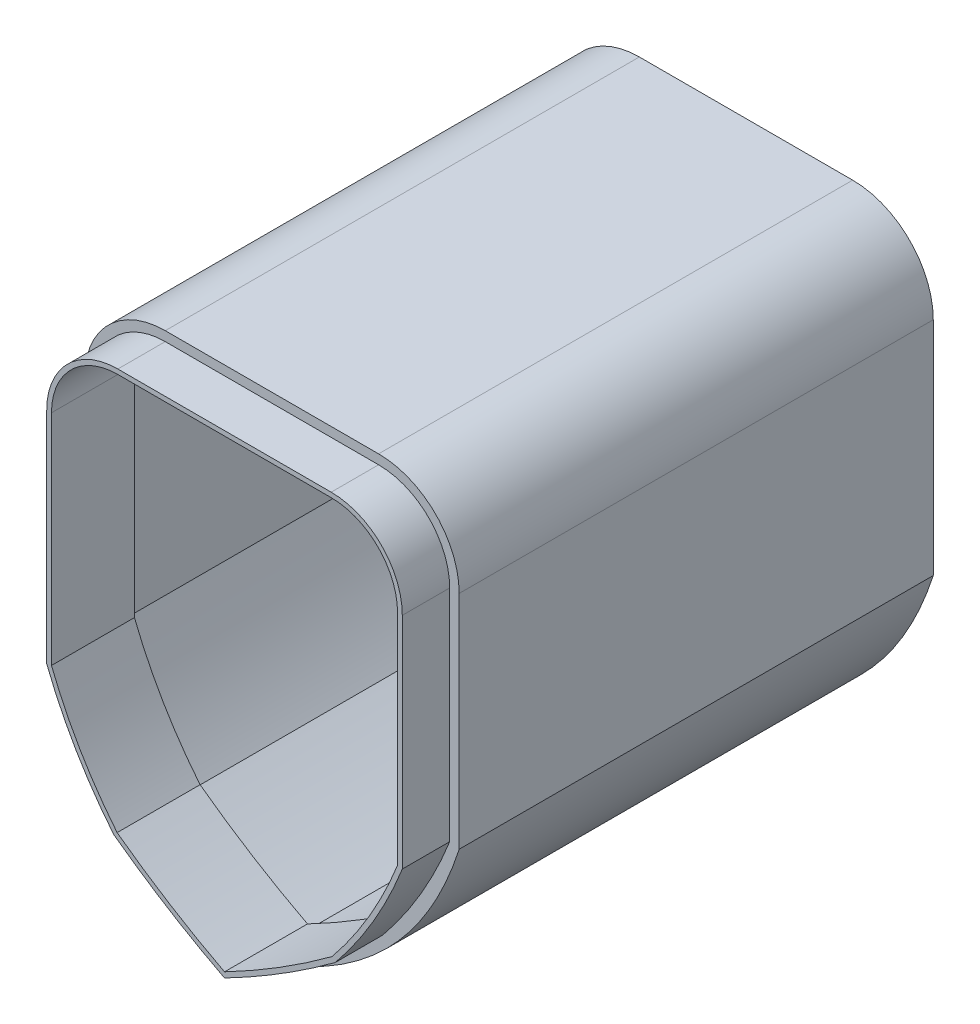
from build123d import *

# Parameters (mm, degrees)
EXTRU_MINCE2_DEPTH      = 200
EPAISSIR5_DEPTH         = 200
EPAISSIR7_DEPTH         = 200
EXTRU_MINCE3_DEPTH      = 20
EXTRU_MINCE3_DEPTH_BACK = 15


# Read off the part's stored shape, not the designer's step: Epaissir5, Epaissir7
with BuildPart() as part:
    # Esquisse3 → Extru.-Mince2 (new body)
    with BuildSketch(Plane.XY):
        with BuildLine():
            Line((-206.649507199, -11.92714811), (-206.649507199, -3.47401752))
            Line((-206.649507199, -3.47401752), (-206.649507199, 81.52598248))
            ThreePointArc((-206.649507199, 81.52598248), (-196.691137759, 105.56761304), (-172.649507199, 115.52598248))
            Line((-172.649507199, 115.52598248), (-82.649507199, 115.52598248))
            ThreePointArc((-82.649507199, 115.52598248), (-58.607876638, 105.56761304), (-48.649507199, 81.52598248))
            Line((-48.649507199, 81.52598248), (-48.649507199, -11.92714811))
            ThreePointArc((-48.649507199, -11.92714811), (-61.399009455, -38.338842544), (-78.173060849, -62.396244951))
            ThreePointArc((-78.173060849, -62.396244951), (-102.275198337, -78.711501116), (-127.649507199, -92.967905467))
            ThreePointArc((-127.649507199, -92.967905467), (-153.023816061, -78.711501116), (-177.125953549, -62.396244951))
            ThreePointArc((-177.125953549, -62.396244951), (-193.900004942, -38.338842544), (-206.649507199, -11.92714811))
        make_face()
        with BuildLine():
            Line((-202.649507199, -11.17401752), (-202.649507199, -3.47401752))
            Line((-202.649507199, -3.47401752), (-202.649507199, 81.52598248))
            ThreePointArc((-202.649507199, 81.52598248), (-193.862710634, 102.739185916), (-172.649507199, 111.52598248))
            Line((-172.649507199, 111.52598248), (-82.649507199, 111.52598248))
            ThreePointArc((-82.649507199, 111.52598248), (-61.436303763, 102.739185916), (-52.649507199, 81.52598248))
            Line((-52.649507199, 81.52598248), (-52.649507199, -11.17401752))
            ThreePointArc((-52.649507199, -11.17401752), (-64.915375774, -36.427970301), (-80.949507199, -59.47401752))
            ThreePointArc((-80.949507199, -59.47401752), (-103.722688687, -74.902894226), (-127.649507199, -88.47401752))
            ThreePointArc((-127.649507199, -88.47401752), (-151.57632571, -74.902894226), (-174.349507199, -59.47401752))
            ThreePointArc((-174.349507199, -59.47401752), (-190.383638623, -36.427970301), (-202.649507199, -11.17401752))
        make_face(mode=Mode.SUBTRACT)
    extrude(amount=EXTRU_MINCE2_DEPTH)

    # Epaissir5 outline → Epaissir5 (add)
    with BuildSketch(Plane.XY):
        with BuildLine():
            add(Edge.make_bspline(
                [(-78.173060849, -62.396244951), (-91.313583381, -75.858349648), (-107.794638855, -86.055391974), (-127.649507199, -92.967905467)],
                knots=[0.501331546, 0.501331546, 0.501331546, 0.501331546, 1, 1, 1, 1], degree=3))
            ThreePointArc((-78.173060849, -62.396244951), (-102.275198337, -78.711501116), (-127.649507199, -92.967905467))
        make_face()
        with BuildLine():
            add(Edge.make_bspline(
                [(-48.649507199, -11.92714811), (-55.127972189, -32.028220402), (-64.962362616, -48.862247174), (-78.173060849, -62.396244951)],
                knots=[0, 0, 0, 0, 0.501331546, 0.501331546, 0.501331546, 0.501331546], degree=3))
            ThreePointArc((-48.649507199, -11.92714811), (-61.399009455, -38.338842545), (-78.173060849, -62.396244951))
        make_face()
    extrude(amount=EPAISSIR5_DEPTH)

    # Epaissir7 outline → Epaissir7 (add)
    with BuildSketch(Plane.XY):
        with BuildLine():
            ThreePointArc((-177.125953549, -62.396244951), (-193.900004942, -38.338842544), (-206.649507199, -11.92714811))
            add(Edge.make_bspline(
                [(-206.649507199, -11.92714811), (-200.171042209, -32.028220402), (-190.336651781, -48.862247174), (-177.125953549, -62.396244951)],
                knots=[0, 0, 0, 0, 0.501331546, 0.501331546, 0.501331546, 0.501331546], degree=3))
        make_face()
        with BuildLine():
            ThreePointArc((-127.649507199, -92.967905467), (-153.023816061, -78.711501116), (-177.125953549, -62.396244951))
            add(Edge.make_bspline(
                [(-177.125953549, -62.396244951), (-163.985431016, -75.858349648), (-147.504375542, -86.055391974), (-127.649507199, -92.967905467)],
                knots=[0.501331546, 0.501331546, 0.501331546, 0.501331546, 1, 1, 1, 1], degree=3))
        make_face()
    extrude(amount=EPAISSIR7_DEPTH)

    # Esquisse7 → Extru.-Mince3 (add, two sides: drawn at the far end of the back side and taken through both)
    with BuildSketch(Plane.XY.offset(200).offset(-EXTRU_MINCE3_DEPTH_BACK)):
        with BuildLine():
            Line((-202.649507199, -11.17401752), (-202.649507199, -3.47401752))
            Line((-202.649507199, -3.47401752), (-202.649507199, 81.52598248))
            ThreePointArc((-202.649507199, 81.52598248), (-193.862710634, 102.739185916), (-172.649507199, 111.52598248))
            Line((-172.649507199, 111.52598248), (-82.649507199, 111.52598248))
            ThreePointArc((-82.649507199, 111.52598248), (-61.436303763, 102.739185916), (-52.649507199, 81.52598248))
            Line((-52.649507199, 81.52598248), (-52.649507199, -11.17401752))
            ThreePointArc((-52.649507199, -11.17401752), (-64.915375774, -36.427970301), (-80.949507199, -59.47401752))
            ThreePointArc((-80.949507199, -59.47401752), (-103.722688687, -74.902894226), (-127.649507199, -88.47401752))
            ThreePointArc((-127.649507199, -88.47401752), (-151.57632571, -74.902894226), (-174.349507199, -59.47401752))
            ThreePointArc((-174.349507199, -59.47401752), (-190.383638623, -36.427970301), (-202.649507199, -11.17401752))
        make_face()
        with BuildLine():
            Line((-200.649507199, -10.794210022), (-200.649507199, -3.47401752))
            Line((-200.649507199, -3.47401752), (-200.649507199, 81.52598248))
            ThreePointArc((-200.649507199, 81.52598248), (-192.448497072, 101.324972353), (-172.649507199, 109.52598248))
            Line((-172.649507199, 109.52598248), (-82.649507199, 109.52598248))
            ThreePointArc((-82.649507199, 109.52598248), (-62.850517326, 101.324972353), (-54.649507199, 81.52598248))
            Line((-54.649507199, 81.52598248), (-54.649507199, -10.794210022))
            ThreePointArc((-54.649507199, -10.794210022), (-66.673062941, -35.471620796), (-82.338728425, -58.013302636))
            ThreePointArc((-82.338728425, -58.013302636), (-104.44621972, -72.997686116), (-127.649507199, -86.221920301))
            ThreePointArc((-127.649507199, -86.221920301), (-150.852794678, -72.997686116), (-172.960285972, -58.013302636))
            ThreePointArc((-172.960285972, -58.013302636), (-188.625951457, -35.471620796), (-200.649507199, -10.794210022))
        make_face(mode=Mode.SUBTRACT)
    extrude(amount=EXTRU_MINCE3_DEPTH + EXTRU_MINCE3_DEPTH_BACK)


solid = part.part
